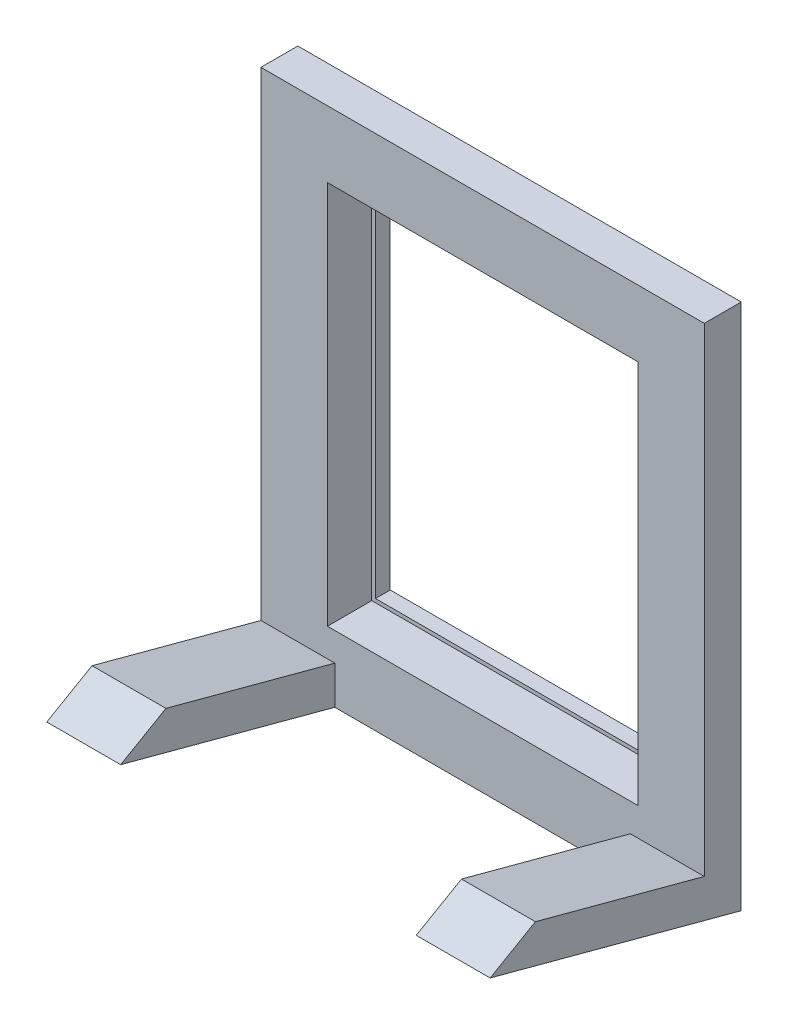
from build123d import *

# Parameters (mm, degrees)
EXTRUDE_1_DEPTH      = 6
EXTRUDE_1_DEPTH_BACK = 2
SKETCH_1_W           = 60
SKETCH_1_H           = 70
SKETCH_1_W_2         = 41
SKETCH_1_H_2         = 51
SKETCH_2_W           = 42
SKETCH_2_H           = 52
CUT_EXTRUDE_2_DEPTH  = 47.486557197
SKETCH_3_W           = 4
SKETCH_3_H           = 3
CHAMFER_2_SIZE       = 3
EXTRUDE_2_DEPTH      = 10
EXTRUDE_3_DEPTH      = 60


with BuildPart() as part:
    # Эскиз1 → Бобышка-Вытянуть1 (new, two sides: drawn at the far end of the back side and taken through both)
    with BuildSketch(Plane.XY.offset(-EXTRUDE_1_DEPTH_BACK)):
        Rectangle(SKETCH_1_W, SKETCH_1_H)
        Rectangle(SKETCH_1_W_2, SKETCH_1_H_2, mode=Mode.SUBTRACT)
    extrude(amount=EXTRUDE_1_DEPTH + EXTRUDE_1_DEPTH_BACK)

    # Эскиз2 → Вырез-Вытянуть2 (cut, through all)
    with BuildSketch(Plane(origin=(0, 0, 0), x_dir=(-1, 0, 0), z_dir=(0, 0, -1))):
        Rectangle(SKETCH_2_W, SKETCH_2_H)
    extrude(amount=-CUT_EXTRUDE_2_DEPTH, mode=Mode.SUBTRACT)

    # Вырез-По траектории1: sweep along a path in Эскиз4
    with BuildLine(Plane(origin=(0, 0, -2), x_dir=(-1, 0, 0), z_dir=(0, 0, -1))) as sweep_1_path:
        Line((-30, 35), (-30, -35))
        Line((-30, -35), (30, -35))
        Line((30, -35), (30, 35))
        Line((30, 35), (-30, 35))
    # Эскиз3 → Вырез-По траектории1 (sweep, cut)
    with BuildSketch(Plane(origin=(0, -35, 0), x_dir=(-1, 0, 0), z_dir=(0, -1, 0))):
        with Locations((-28, 0.5)):
            Rectangle(SKETCH_3_W, SKETCH_3_H)
    sweep(path=sweep_1_path.line, transition=Transition.RIGHT, mode=Mode.SUBTRACT)

    # Фаска2
    chamfer_2_edges = [part.edges().sort_by_distance(p)[0] for p in [
        (26, 0, -2),
        (0, 31, -2),
        (-26, 0, -2),
        (0, -31, -2),
    ]]
    chamfer(chamfer_2_edges, length=CHAMFER_2_SIZE - 0.0001)  # a hair under: the kernel refuses the full size

    # Эскиз5 → Бобышка-Вытянуть2 (add)
    with BuildSketch(Plane(origin=(30, 0, 0), x_dir=(0, 0, -1), z_dir=(1, 0, 0))):
        Polygon((-34.977774789, -27.235428647), (-6, -35), (-6, -29.823619098), (-28.854050432, -23.699894741), align=None)
    extrude_2 = extrude(amount=-EXTRUDE_2_DEPTH)

    # Зеркальное отражение1: Бобышка-Вытянуть2 across plane
    add(extrude_2.mirror(Plane(origin=(0, 0, 0), x_dir=(0, 0, 1), z_dir=(1, 0, 0))))

    # Эскиз6 → Бобышка-Вытянуть3 (add)
    with BuildSketch(Plane(origin=(30, 0, 0), x_dir=(0, 0, -1), z_dir=(1, 0, 0))):
        Polygon((-6, -35), (-1, -36.339745962), (-1, -35), align=None)
    extrude(amount=-EXTRUDE_3_DEPTH)


solid = part.part
